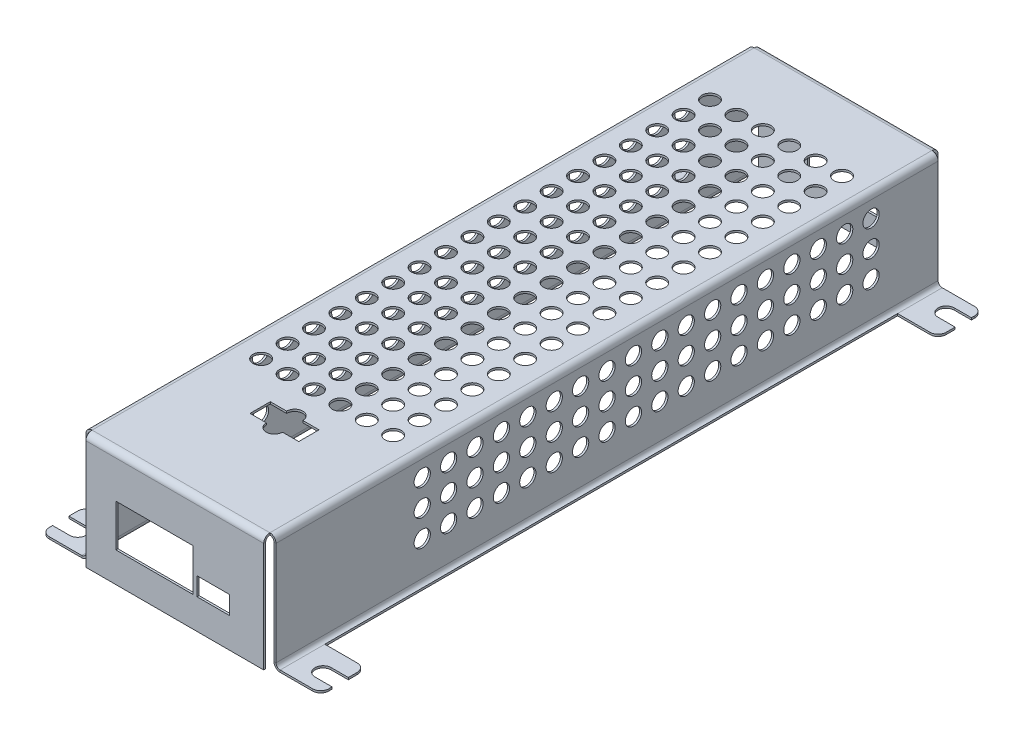
from build123d import *

# Parameters (mm, degrees)
BASE_FLANGE1_DEPTH      = 81.5
EDGE_FLANGE1_DEPTH      = 43.768
EDGE_FLANGE1_BEND_DEPTH = 43.768
SKETCH12_W              = 9.984
SKETCH12_H              = 141
CUT_EXTRUDE1_DEPTH      = 10
CUT_EXTRUDE2_DEPTH      = 10
FILLET1_R               = 2
SKETCH14_R              = 2
CUT_EXTRUDE3_DEPTH      = 10
SKETCH15_R              = 2
CUT_EXTRUDE4_DEPTH      = 105.95949817
CUT_EXTRUDE5_DEPTH      = 10
SKETCH17_W              = 19
SKETCH17_H              = 10.4
SKETCH17_W_2            = 8
SKETCH17_H_2            = 4.481964473
CUT_EXTRUDE6_DEPTH      = 10
SKETCH18_W              = 19.431702054
SKETCH18_H              = 11.670713485
CUT_EXTRUDE7_DEPTH      = 10


# Sheet-metal steps are written as plain solids
with BuildPart() as part:
    # Sketch1 → Base-Flange1 (new, symmetric)
    with BuildSketch(Plane.XY):
        with BuildLine():
            Line((-34.4, 0), (-24.416, 0))
            ThreePointArc((-24.416, 0), (-23.69757951, 0.29757951), (-23.4, 1.016))
            Line((-23.4, 1.016), (-23.4, 26.484))
            ThreePointArc((-23.4, 26.484), (-22.95597388, 27.55597388), (-21.884, 28))
            Line((-21.884, 28), (21.884, 28))
            ThreePointArc((21.884, 28), (22.95597388, 27.55597388), (23.4, 26.484))
            Line((23.4, 26.484), (23.4, 1.016))
            ThreePointArc((23.4, 1.016), (23.69757951, 0.29757951), (24.416, 0))
            Line((24.416, 0), (34.4, 0))
            Line((34.4, 0), (34.4, -0.5))
            Line((34.4, -0.5), (24.416, -0.5))
            ThreePointArc((24.416, -0.5), (23.34402612, -0.05597388), (22.9, 1.016))
            Line((22.9, 1.016), (22.9, 26.484))
            ThreePointArc((22.9, 26.484), (22.60242049, 27.20242049), (21.884, 27.5))
            Line((21.884, 27.5), (-21.884, 27.5))
            ThreePointArc((-21.884, 27.5), (-22.60242049, 27.20242049), (-22.9, 26.484))
            Line((-22.9, 26.484), (-22.9, 1.016))
            ThreePointArc((-22.9, 1.016), (-23.34402612, -0.05597388), (-24.416, -0.5))
            Line((-24.416, -0.5), (-34.4, -0.5))
            Line((-34.4, -0.5), (-34.4, 0))
        make_face()
    extrude(amount=BASE_FLANGE1_DEPTH, both=True)

    # Edge-Flange1 section (across the edge) → Edge-Flange1 (add)
    with BuildSketch(Plane(origin=(21.884, 27.5, 82.516), x_dir=(0, 0, -1), z_dir=(-1, 0, 0))):
        with BuildLine():
            Line((-0.5, 1.016), (-0.5, 28))
            Line((-0.5, 28), (0, 28))
            Line((0, 28), (0, 1.016))
            ThreePointArc((0, 1.016), (0.29757951, 0.29757951), (1.016, 0))
            Line((1.016, 0), (1.016, -0.5))
            ThreePointArc((1.016, -0.5), (-0.05597388, -0.05597388), (-0.5, 1.016))
        make_face()
    extrude(amount=EDGE_FLANGE1_DEPTH)

    # Edge-Flange1 section 2 (across the edge) → Edge-Flange1 bend (add)
    with BuildSketch(Plane(origin=(-21.884, 27.5, -82.516), x_dir=(0, 0, 1), z_dir=(1, 0, 0))):
        with BuildLine():
            Line((-0.5, 1.016), (-0.5, 28))
            Line((-0.5, 28), (0, 28))
            Line((0, 28), (0, 1.016))
            ThreePointArc((0, 1.016), (0.29757951, 0.29757951), (1.016, 0))
            Line((1.016, 0), (1.016, -0.5))
            ThreePointArc((1.016, -0.5), (-0.05597388, -0.05597388), (-0.5, 1.016))
        make_face()
    extrude(amount=EDGE_FLANGE1_BEND_DEPTH)

    # Sketch12 → Cut-Extrude1 (cut)
    with BuildSketch(Plane(origin=(0, 0, 0), x_dir=(1, 0, 0), z_dir=(0, 1, 0))):
        with Locations((-29.408, 0)):
            Rectangle(SKETCH12_W, SKETCH12_H)
        with Locations((29.408, 0)):
            Rectangle(SKETCH12_W, SKETCH12_H)
    extrude(amount=-CUT_EXTRUDE1_DEPTH, mode=Mode.SUBTRACT)

    # Sketch13 → Cut-Extrude2 (cut)
    with BuildSketch(Plane(origin=(0, 0, 0), x_dir=(1, 0, 0), z_dir=(0, 1, 0))):
        with BuildLine():
            Line((-30.2, 78.7), (-34.4, 78.7))
            Line((-34.4, 78.7), (-34.4, 74.7))
            Line((-34.4, 74.7), (-30.2, 74.7))
            ThreePointArc((-30.2, 74.7), (-28.2, 76.7), (-30.2, 78.7))
        make_face()
        with BuildLine():
            Line((-34.4, -78.7), (-34.4, -74.7))
            Line((-34.4, -74.7), (-30.2, -74.7))
            ThreePointArc((-30.2, -74.7), (-28.2, -76.7), (-30.2, -78.7))
            Line((-30.2, -78.7), (-34.4, -78.7))
        make_face()
        with BuildLine():
            Line((30.2, -78.7), (34.4, -78.7))
            Line((34.4, -78.7), (34.4, -74.7))
            Line((34.4, -74.7), (30.2, -74.7))
            ThreePointArc((30.2, -74.7), (28.2, -76.7), (30.2, -78.7))
        make_face()
        with BuildLine():
            Line((34.4, 78.7), (34.4, 74.7))
            Line((34.4, 74.7), (30.2, 74.7))
            ThreePointArc((30.2, 74.7), (28.2, 76.7), (30.2, 78.7))
            Line((30.2, 78.7), (34.4, 78.7))
        make_face()
    extrude(amount=-CUT_EXTRUDE2_DEPTH, mode=Mode.SUBTRACT)

    # Fillet1
    fillet1_edges = [part.edges().sort_by_distance(p)[0] for p in [
        (-34.4, -0.25, 70.5),
        (-34.4, -0.25, -70.5),
        (34.4, -0.25, -70.5),
        (34.4, -0.25, 70.5),
        (-34.4, -0.25, -81.5),
        (34.4, -0.25, -81.5),
        (-34.4, -0.25, 81.5),
        (34.4, -0.25, 81.5),
    ]]
    fillet(fillet1_edges, radius=FILLET1_R)

    # Sketch14 → Cut-Extrude3 (cut)
    with BuildSketch(Plane(origin=(0, 28, 0), x_dir=(1, 0, 0), z_dir=(0, 1, 0))):
        with Locations(Location((-3.25, 65, 0), (0, 0, 270))):
            Circle(SKETCH14_R)
        with Locations(Location((-9.75, 65, 0), (0, 0, 270))):
            Circle(SKETCH14_R)
        with Locations(Location((-16.25, 65, 0), (0, 0, 270))):
            Circle(SKETCH14_R)
        with Locations(Location((-9.75, 58.5, 0), (0, 0, 270))):
            Circle(SKETCH14_R)
        with Locations(Location((-16.25, 58.5, 0), (0, 0, 270))):
            Circle(SKETCH14_R)
        with Locations(Location((-9.75, 52, 0), (0, 0, 270))):
            Circle(SKETCH14_R)
        with Locations(Location((-16.25, 52, 0), (0, 0, 270))):
            Circle(SKETCH14_R)
        with Locations(Location((-9.75, 45.5, 0), (0, 0, 270))):
            Circle(SKETCH14_R)
        with Locations(Location((-16.25, 45.5, 0), (0, 0, 270))):
            Circle(SKETCH14_R)
        with Locations(Location((-9.75, 39, 0), (0, 0, 270))):
            Circle(SKETCH14_R)
        with Locations(Location((-16.25, 39, 0), (0, 0, 270))):
            Circle(SKETCH14_R)
        with Locations(Location((-9.75, 32.5, 0), (0, 0, 270))):
            Circle(SKETCH14_R)
        with Locations(Location((-16.25, 32.5, 0), (0, 0, 270))):
            Circle(SKETCH14_R)
        with Locations(Location((-9.75, 26, 0), (0, 0, 270))):
            Circle(SKETCH14_R)
        with Locations(Location((-16.25, 26, 0), (0, 0, 270))):
            Circle(SKETCH14_R)
        with Locations(Location((-9.75, 19.5, 0), (0, 0, 270))):
            Circle(SKETCH14_R)
        with Locations(Location((-16.25, 19.5, 0), (0, 0, 270))):
            Circle(SKETCH14_R)
        with Locations(Location((-9.75, 13, 0), (0, 0, 270))):
            Circle(SKETCH14_R)
        with Locations(Location((-16.25, 13, 0), (0, 0, 270))):
            Circle(SKETCH14_R)
        with Locations(Location((-9.75, 6.5, 0), (0, 0, 270))):
            Circle(SKETCH14_R)
        with Locations(Location((-16.25, 6.5, 0), (0, 0, 270))):
            Circle(SKETCH14_R)
        with Locations(Location((-9.75, 0, 0), (0, 0, 270))):
            Circle(SKETCH14_R)
        with Locations(Location((-16.25, 0, 0), (0, 0, 270))):
            Circle(SKETCH14_R)
        with Locations(Location((-9.75, -6.5, 0), (0, 0, 270))):
            Circle(SKETCH14_R)
        with Locations(Location((-16.25, -6.5, 0), (0, 0, 270))):
            Circle(SKETCH14_R)
        with Locations(Location((-9.75, -13, 0), (0, 0, 270))):
            Circle(SKETCH14_R)
        with Locations(Location((-16.25, -13, 0), (0, 0, 270))):
            Circle(SKETCH14_R)
        with Locations(Location((-9.75, -19.5, 0), (0, 0, 270))):
            Circle(SKETCH14_R)
        with Locations(Location((-16.25, -19.5, 0), (0, 0, 270))):
            Circle(SKETCH14_R)
        with Locations(Location((-9.75, -26, 0), (0, 0, 270))):
            Circle(SKETCH14_R)
        with Locations(Location((-16.25, -26, 0), (0, 0, 270))):
            Circle(SKETCH14_R)
        with Locations(Location((-9.75, -32.5, 0), (0, 0, 270))):
            Circle(SKETCH14_R)
        with Locations(Location((-16.25, -32.5, 0), (0, 0, 270))):
            Circle(SKETCH14_R)
        with Locations(Location((-9.75, -39, 0), (0, 0, 270))):
            Circle(SKETCH14_R)
        with Locations(Location((-16.25, -39, 0), (0, 0, 270))):
            Circle(SKETCH14_R)
        with Locations(Location((-9.75, -45.5, 0), (0, 0, 270))):
            Circle(SKETCH14_R)
        with Locations(Location((-16.25, -45.5, 0), (0, 0, 270))):
            Circle(SKETCH14_R)
        with Locations(Location((-3.25, 58.5, 0), (0, 0, 270))):
            Circle(SKETCH14_R)
        with Locations(Location((-3.25, 52, 0), (0, 0, 270))):
            Circle(SKETCH14_R)
        with Locations(Location((-3.25, 45.5, 0), (0, 0, 270))):
            Circle(SKETCH14_R)
        with Locations(Location((-3.25, 39, 0), (0, 0, 270))):
            Circle(SKETCH14_R)
        with Locations(Location((-3.25, 32.5, 0), (0, 0, 270))):
            Circle(SKETCH14_R)
        with Locations(Location((-3.25, 26, 0), (0, 0, 270))):
            Circle(SKETCH14_R)
        with Locations(Location((-3.25, 19.5, 0), (0, 0, 270))):
            Circle(SKETCH14_R)
        with Locations(Location((-3.25, 13, 0), (0, 0, 270))):
            Circle(SKETCH14_R)
        with Locations(Location((-3.25, 6.5, 0), (0, 0, 270))):
            Circle(SKETCH14_R)
        with Locations(Location((-3.25, 0, 0), (0, 0, 270))):
            Circle(SKETCH14_R)
        with Locations(Location((-3.25, -6.5, 0), (0, 0, 270))):
            Circle(SKETCH14_R)
        with Locations(Location((-3.25, -13, 0), (0, 0, 270))):
            Circle(SKETCH14_R)
        with Locations(Location((-3.25, -19.5, 0), (0, 0, 270))):
            Circle(SKETCH14_R)
        with Locations(Location((-3.25, -26, 0), (0, 0, 270))):
            Circle(SKETCH14_R)
        with Locations(Location((-3.25, -32.5, 0), (0, 0, 270))):
            Circle(SKETCH14_R)
        with Locations(Location((-3.25, -39, 0), (0, 0, 270))):
            Circle(SKETCH14_R)
        with Locations(Location((-3.25, -45.5, 0), (0, 0, 270))):
            Circle(SKETCH14_R)
        with Locations(Location((3.25, -45.5, 0), (0, 0, 270))):
            Circle(SKETCH14_R)
        with Locations(Location((3.25, -39, 0), (0, 0, 270))):
            Circle(SKETCH14_R)
        with Locations(Location((3.25, -32.5, 0), (0, 0, 270))):
            Circle(SKETCH14_R)
        with Locations(Location((3.25, -26, 0), (0, 0, 270))):
            Circle(SKETCH14_R)
        with Locations(Location((3.25, -19.5, 0), (0, 0, 270))):
            Circle(SKETCH14_R)
        with Locations(Location((3.25, -13, 0), (0, 0, 270))):
            Circle(SKETCH14_R)
        with Locations(Location((3.25, -6.5, 0), (0, 0, 270))):
            Circle(SKETCH14_R)
        with Locations(Location((3.25, 0, 0), (0, 0, 270))):
            Circle(SKETCH14_R)
        with Locations(Location((3.25, 6.5, 0), (0, 0, 270))):
            Circle(SKETCH14_R)
        with Locations(Location((3.25, 13, 0), (0, 0, 270))):
            Circle(SKETCH14_R)
        with Locations(Location((3.25, 19.5, 0), (0, 0, 270))):
            Circle(SKETCH14_R)
        with Locations(Location((3.25, 26, 0), (0, 0, 270))):
            Circle(SKETCH14_R)
        with Locations(Location((3.25, 32.5, 0), (0, 0, 270))):
            Circle(SKETCH14_R)
        with Locations(Location((3.25, 39, 0), (0, 0, 270))):
            Circle(SKETCH14_R)
        with Locations(Location((3.25, 45.5, 0), (0, 0, 270))):
            Circle(SKETCH14_R)
        with Locations(Location((3.25, 52, 0), (0, 0, 270))):
            Circle(SKETCH14_R)
        with Locations(Location((3.25, 58.5, 0), (0, 0, 270))):
            Circle(SKETCH14_R)
        with Locations(Location((16.25, -45.5, 0), (0, 0, 270))):
            Circle(SKETCH14_R)
        with Locations(Location((9.75, -45.5, 0), (0, 0, 270))):
            Circle(SKETCH14_R)
        with Locations(Location((16.25, -39, 0), (0, 0, 270))):
            Circle(SKETCH14_R)
        with Locations(Location((9.75, -39, 0), (0, 0, 270))):
            Circle(SKETCH14_R)
        with Locations(Location((16.25, -32.5, 0), (0, 0, 270))):
            Circle(SKETCH14_R)
        with Locations(Location((9.75, -32.5, 0), (0, 0, 270))):
            Circle(SKETCH14_R)
        with Locations(Location((16.25, -26, 0), (0, 0, 270))):
            Circle(SKETCH14_R)
        with Locations(Location((9.75, -26, 0), (0, 0, 270))):
            Circle(SKETCH14_R)
        with Locations(Location((16.25, -19.5, 0), (0, 0, 270))):
            Circle(SKETCH14_R)
        with Locations(Location((9.75, -19.5, 0), (0, 0, 270))):
            Circle(SKETCH14_R)
        with Locations(Location((16.25, -13, 0), (0, 0, 270))):
            Circle(SKETCH14_R)
        with Locations(Location((9.75, -13, 0), (0, 0, 270))):
            Circle(SKETCH14_R)
        with Locations(Location((16.25, -6.5, 0), (0, 0, 270))):
            Circle(SKETCH14_R)
        with Locations(Location((9.75, -6.5, 0), (0, 0, 270))):
            Circle(SKETCH14_R)
        with Locations(Location((16.25, 0, 0), (0, 0, 270))):
            Circle(SKETCH14_R)
        with Locations(Location((9.75, 0, 0), (0, 0, 270))):
            Circle(SKETCH14_R)
        with Locations(Location((16.25, 6.5, 0), (0, 0, 270))):
            Circle(SKETCH14_R)
        with Locations(Location((9.75, 6.5, 0), (0, 0, 270))):
            Circle(SKETCH14_R)
        with Locations(Location((16.25, 13, 0), (0, 0, 270))):
            Circle(SKETCH14_R)
        with Locations(Location((9.75, 13, 0), (0, 0, 270))):
            Circle(SKETCH14_R)
        with Locations(Location((16.25, 19.5, 0), (0, 0, 270))):
            Circle(SKETCH14_R)
        with Locations(Location((9.75, 19.5, 0), (0, 0, 270))):
            Circle(SKETCH14_R)
        with Locations(Location((16.25, 26, 0), (0, 0, 270))):
            Circle(SKETCH14_R)
        with Locations(Location((9.75, 26, 0), (0, 0, 270))):
            Circle(SKETCH14_R)
        with Locations(Location((16.25, 32.5, 0), (0, 0, 270))):
            Circle(SKETCH14_R)
        with Locations(Location((9.75, 32.5, 0), (0, 0, 270))):
            Circle(SKETCH14_R)
        with Locations(Location((16.25, 39, 0), (0, 0, 270))):
            Circle(SKETCH14_R)
        with Locations(Location((9.75, 39, 0), (0, 0, 270))):
            Circle(SKETCH14_R)
        with Locations(Location((16.25, 45.5, 0), (0, 0, 270))):
            Circle(SKETCH14_R)
        with Locations(Location((9.75, 45.5, 0), (0, 0, 270))):
            Circle(SKETCH14_R)
        with Locations(Location((16.25, 52, 0), (0, 0, 270))):
            Circle(SKETCH14_R)
        with Locations(Location((9.75, 52, 0), (0, 0, 270))):
            Circle(SKETCH14_R)
        with Locations(Location((16.25, 58.5, 0), (0, 0, 270))):
            Circle(SKETCH14_R)
        with Locations(Location((9.75, 58.5, 0), (0, 0, 270))):
            Circle(SKETCH14_R)
        with Locations(Location((16.25, 65, 0), (0, 0, 270))):
            Circle(SKETCH14_R)
        with Locations(Location((9.75, 65, 0), (0, 0, 270))):
            Circle(SKETCH14_R)
        with Locations(Location((3.25, 65, 0), (0, 0, 270))):
            Circle(SKETCH14_R)
    extrude(amount=-CUT_EXTRUDE3_DEPTH, mode=Mode.SUBTRACT)

    # Sketch15 → Cut-Extrude4 (cut, through all)
    with BuildSketch(Plane(origin=(23.4, 0, 0), x_dir=(0, 0, -1), z_dir=(1, 0, 0))):
        with Locations((65, 22.5)):
            Circle(SKETCH15_R)
        with Locations((58.5, 22.5)):
            Circle(SKETCH15_R)
        with Locations((52, 22.5)):
            Circle(SKETCH15_R)
        with Locations((45.5, 22.5)):
            Circle(SKETCH15_R)
        with Locations((39, 22.5)):
            Circle(SKETCH15_R)
        with Locations((32.5, 22.5)):
            Circle(SKETCH15_R)
        with Locations((26, 22.5)):
            Circle(SKETCH15_R)
        with Locations((19.5, 22.5)):
            Circle(SKETCH15_R)
        with Locations((13, 22.5)):
            Circle(SKETCH15_R)
        with Locations((6.5, 22.5)):
            Circle(SKETCH15_R)
        with Locations((0, 22.5)):
            Circle(SKETCH15_R)
        with Locations((-6.5, 22.5)):
            Circle(SKETCH15_R)
        with Locations((-13, 22.5)):
            Circle(SKETCH15_R)
        with Locations((-19.5, 22.5)):
            Circle(SKETCH15_R)
        with Locations((-26, 22.5)):
            Circle(SKETCH15_R)
        with Locations((-32.5, 22.5)):
            Circle(SKETCH15_R)
        with Locations((-39, 22.5)):
            Circle(SKETCH15_R)
        with Locations((-45.5, 22.5)):
            Circle(SKETCH15_R)
        with Locations((58.5, 16)):
            Circle(SKETCH15_R)
        with Locations((52, 16)):
            Circle(SKETCH15_R)
        with Locations((45.5, 16)):
            Circle(SKETCH15_R)
        with Locations((39, 16)):
            Circle(SKETCH15_R)
        with Locations((32.5, 16)):
            Circle(SKETCH15_R)
        with Locations((26, 16)):
            Circle(SKETCH15_R)
        with Locations((19.5, 16)):
            Circle(SKETCH15_R)
        with Locations((13, 16)):
            Circle(SKETCH15_R)
        with Locations((6.5, 16)):
            Circle(SKETCH15_R)
        with Locations((0, 16)):
            Circle(SKETCH15_R)
        with Locations((-6.5, 16)):
            Circle(SKETCH15_R)
        with Locations((-13, 16)):
            Circle(SKETCH15_R)
        with Locations((-19.5, 16)):
            Circle(SKETCH15_R)
        with Locations((-26, 16)):
            Circle(SKETCH15_R)
        with Locations((-32.5, 16)):
            Circle(SKETCH15_R)
        with Locations((-39, 16)):
            Circle(SKETCH15_R)
        with Locations((-45.5, 16)):
            Circle(SKETCH15_R)
        with Locations((58.5, 9.5)):
            Circle(SKETCH15_R)
        with Locations((52, 9.5)):
            Circle(SKETCH15_R)
        with Locations((45.5, 9.5)):
            Circle(SKETCH15_R)
        with Locations((39, 9.5)):
            Circle(SKETCH15_R)
        with Locations((32.5, 9.5)):
            Circle(SKETCH15_R)
        with Locations((26, 9.5)):
            Circle(SKETCH15_R)
        with Locations((19.5, 9.5)):
            Circle(SKETCH15_R)
        with Locations((13, 9.5)):
            Circle(SKETCH15_R)
        with Locations((6.5, 9.5)):
            Circle(SKETCH15_R)
        with Locations((0, 9.5)):
            Circle(SKETCH15_R)
        with Locations((-6.5, 9.5)):
            Circle(SKETCH15_R)
        with Locations((-13, 9.5)):
            Circle(SKETCH15_R)
        with Locations((-19.5, 9.5)):
            Circle(SKETCH15_R)
        with Locations((-26, 9.5)):
            Circle(SKETCH15_R)
        with Locations((-32.5, 9.5)):
            Circle(SKETCH15_R)
        with Locations((-39, 9.5)):
            Circle(SKETCH15_R)
        with Locations((-45.5, 9.5)):
            Circle(SKETCH15_R)
        with Locations((65, 16)):
            Circle(SKETCH15_R)
        with Locations((65, 9.5)):
            Circle(SKETCH15_R)
    extrude(amount=-CUT_EXTRUDE4_DEPTH, mode=Mode.SUBTRACT)

    # Sketch16 → Cut-Extrude5 (cut)
    with BuildSketch(Plane(origin=(0, 28, 0), x_dir=(1, 0, 0), z_dir=(0, 1, 0))):
        with BuildLine():
            Line((-6, -53.5), (-2, -53.5))
            ThreePointArc((-2, -53.5), (0, -51.5), (2, -53.5))
            Line((2, -53.5), (6, -53.5))
            Line((6, -53.5), (6, -58.5))
            Line((6, -58.5), (2, -58.5))
            ThreePointArc((2, -58.5), (0, -60.5), (-2, -58.5))
            Line((-2, -58.5), (-6, -58.5))
            Line((-6, -58.5), (-6, -53.5))
        make_face()
    extrude(amount=-CUT_EXTRUDE5_DEPTH, mode=Mode.SUBTRACT)

    # Sketch17 → Cut-Extrude6 (cut)
    with BuildSketch(Plane.XY.offset(83.016)):
        with Locations((-5, 12.1)):
            Rectangle(SKETCH17_W, SKETCH17_H)
        with Locations((9.5, 9.140982237)):
            Rectangle(SKETCH17_W_2, SKETCH17_H_2)
    extrude(amount=-CUT_EXTRUDE6_DEPTH, mode=Mode.SUBTRACT)

    # Sketch18 → Cut-Extrude7 (cut)
    with BuildSketch(Plane(origin=(0, 0, -83.016), x_dir=(-1, 0, 0), z_dir=(0, 0, -1))):
        with Locations((0, 11.823997762)):
            Rectangle(SKETCH18_W, SKETCH18_H)
    extrude(amount=-CUT_EXTRUDE7_DEPTH, mode=Mode.SUBTRACT)


solid = part.part
